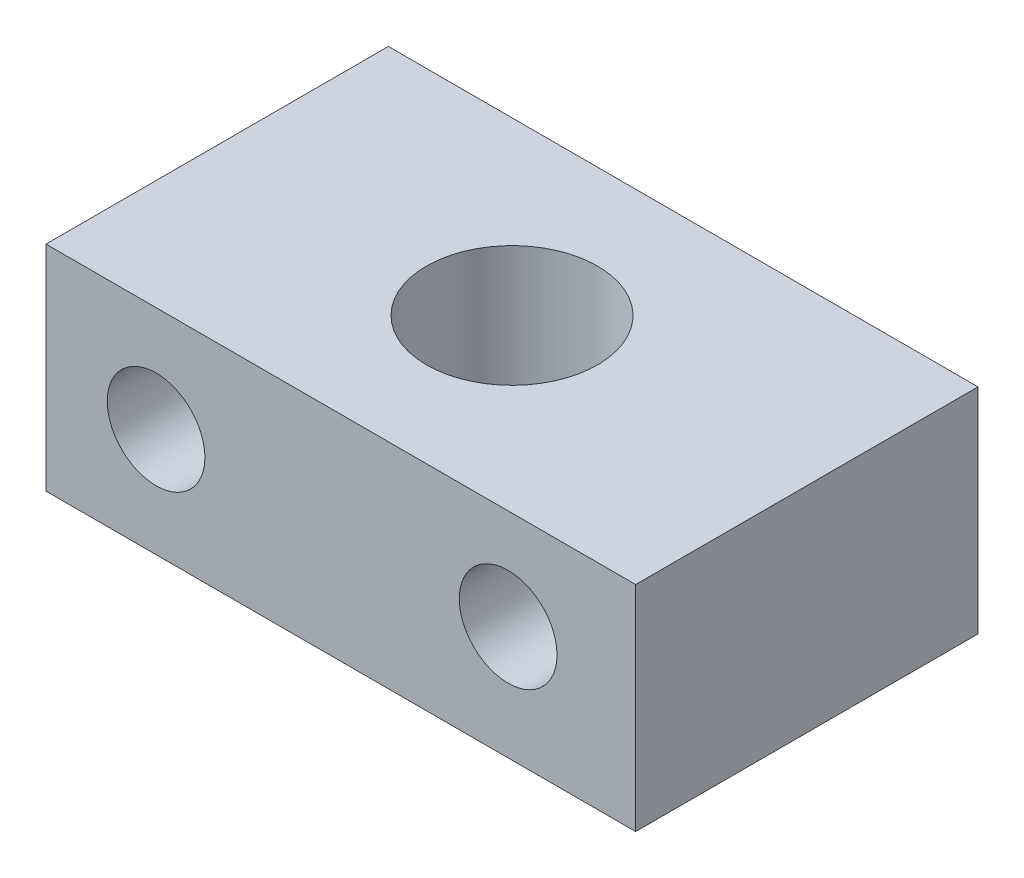
from build123d import *

# Parameters (mm, degrees)
SKETCH2_W            = 35
SKETCH2_H            = 20.32
SKETCH2_R            = 5.08
BOSS_EXTRUDE1_DEPTH  = 12.7
M5_CLEARANCE_HOLE1_D = 5.8


with BuildPart() as part:
    # Sketch2 → Boss-Extrude1 (new body)
    with BuildSketch(Plane(origin=(0, 0, 0), x_dir=(1, 0, 0), z_dir=(0, 1, 0))):
        with Locations((17.5, 10.16)):
            Rectangle(SKETCH2_W, SKETCH2_H)
        with Locations((17.5, 10.16)):
            Circle(SKETCH2_R, mode=Mode.SUBTRACT)
    extrude(amount=BOSS_EXTRUDE1_DEPTH)

    # M5 Clearance Hole1 (through all)
    with Locations(Plane.XY):
        with Locations((6.533064905, 6.443946019), (27.430795857, 6.744457137)):
            Hole(M5_CLEARANCE_HOLE1_D / 2)


solid = part.part
